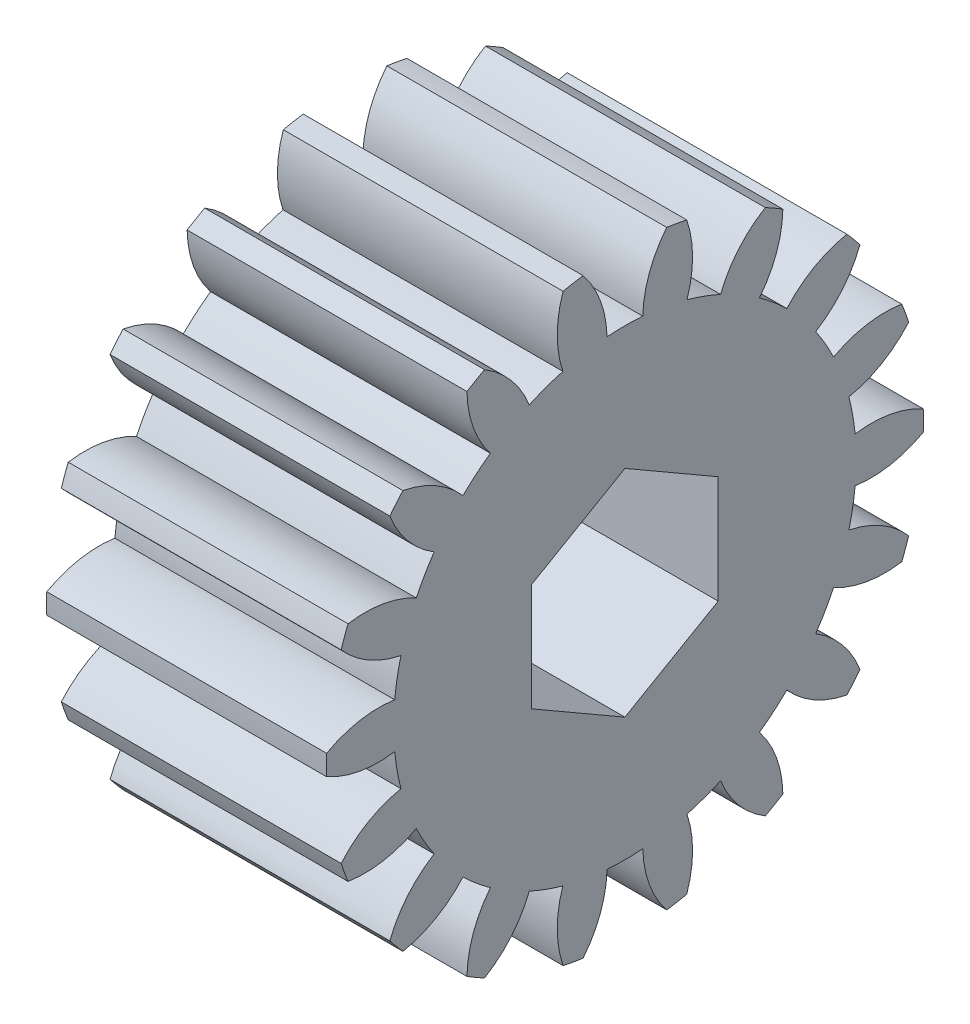
from build123d import *

# Parameters (mm, degrees)
BASPROSKE_W              = 7.5
BASPROSKE_H              = 8
TOOTHCUT_DEPTH           = 14.57387196
TEETHCUTS_COUNT          = 18
TEETHCUTS_ANGLE          = 340
BORSKE_R                 = 2.5
BORE_DEPTH               = 50.0000508
TAGLIO_ESTRUSIONE1_DEPTH = 10


with BuildPart() as part:
    # BasProSke → Base-Revolve (revolve)
    with BuildSketch(Plane(origin=(0, 0, 0), x_dir=(1, 0, 0), z_dir=(0, 1, 0))):
        with Locations((3.75, 4)):
            Rectangle(BASPROSKE_W, BASPROSKE_H)
    revolve(axis=Axis((-10, 0, 0), (1, 0, 0)))

    # TooCutSke → ToothCut (cut, through all)
    with BuildSketch(Plane(origin=(0, 0, 0), x_dir=(0, 0, -1), z_dir=(1, 0, 0))):
        with BuildLine():
            ThreePointArc((0.478981505, 6.180467435), (0, 6.199), (-0.478981505, 6.180467435))
            ThreePointArc((-0.478981505, 6.180467435), (-0.660732846, 7.117783932), (-1.138936203, 7.944172045))
            ThreePointArc((-1.138936203, 7.944172045), (0, 8.0254), (1.138936203, 7.944172045))
            ThreePointArc((1.138936203, 7.944172045), (0.660732846, 7.117783932), (0.478981505, 6.180467435))
        make_face()
    toothcut = extrude(amount=TOOTHCUT_DEPTH, mode=Mode.SUBTRACT)

    # TeethCuts: ToothCut ×18 about axis
    teethcuts_axis = Axis((-10, 0, 0), (1, 0, 0))
    for i in range(1, TEETHCUTS_COUNT):
        add(toothcut.rotate(teethcuts_axis, i * TEETHCUTS_ANGLE / (TEETHCUTS_COUNT - 1)), mode=Mode.SUBTRACT)

    # BorSke → Bore (cut, symmetric)
    with BuildSketch(Plane(origin=(0, 0, 0), x_dir=(0, 0, -1), z_dir=(1, 0, 0))):
        Circle(BORSKE_R)
    extrude(amount=BORE_DEPTH, both=True, mode=Mode.SUBTRACT)

    # Schizzo2 → Taglio-Estrusione1 (cut)
    with BuildSketch(Plane(origin=(7.5, 0, 0), x_dir=(0, 0, -1), z_dir=(1, 0, 0))):
        Polygon((0, 2.886751346), (-2.5, 1.443375673), (-2.5, -1.443375673), (0, -2.886751346), (2.5, -1.443375673), (2.5, 1.443375673), align=None)
    extrude(amount=-TAGLIO_ESTRUSIONE1_DEPTH, mode=Mode.SUBTRACT)


solid = part.part
